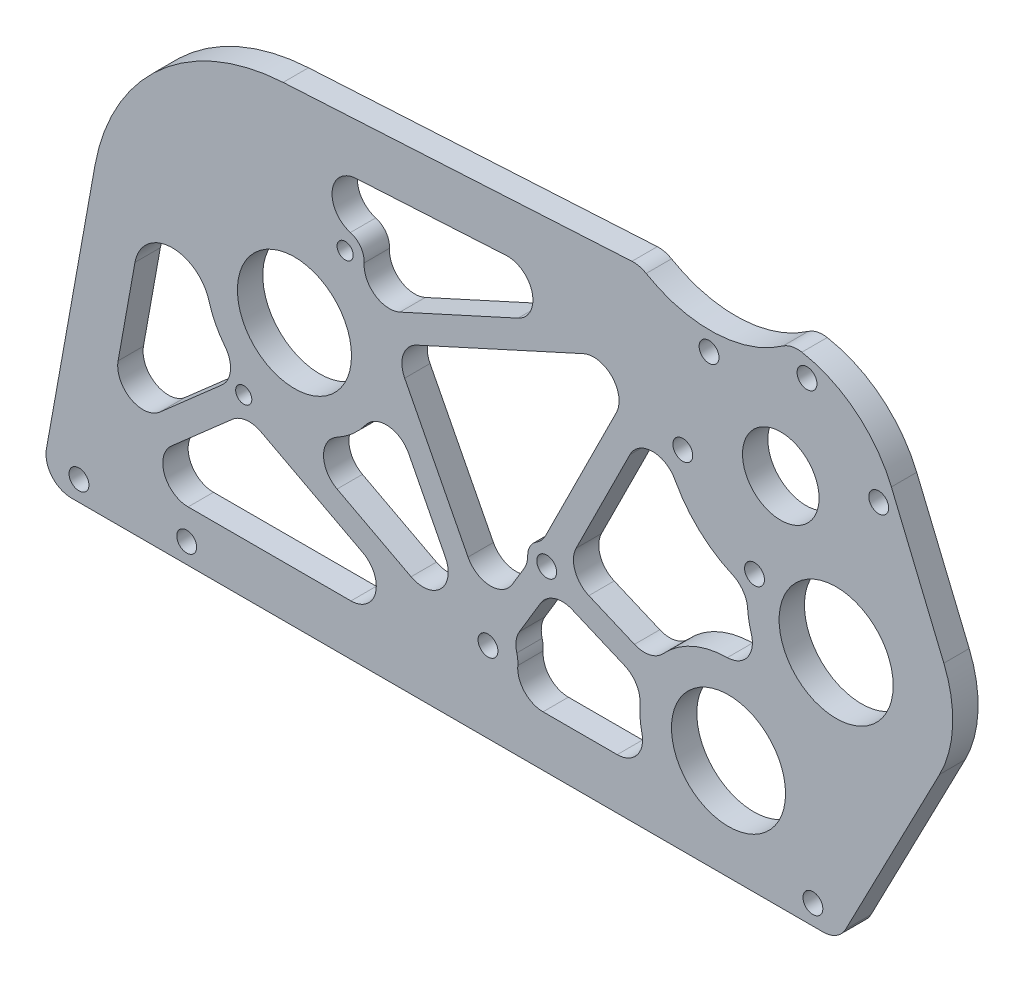
from build123d import *

# Parameters (mm, degrees)
SKETCH7_R           = 2.4892
SKETCH7_R_2         = 14.2875
SKETCH7_R_3         = 9.5885
BOSS_EXTRUDE1_DEPTH = 6.35
FILLET1_R           = 6.35
SKETCH8_R           = 2.0193
CUT_EXTRUDE1_DEPTH  = 423.140912796
CUT_EXTRUDE2_DEPTH  = 423.140912796
FILLET2_R           = 6.35
CUT_EXTRUDE3_DEPTH  = 423.140912939
FILLET3_R           = 6.35


with BuildPart() as part:
    # Sketch7 → Boss-Extrude1 (new body)
    with BuildSketch(Plane.XY):
        with BuildLine():
            Line((149.565619556, 271.446866391), (272.538912647, 278.318852655))
            ThreePointArc((272.538912647, 278.318852655), (290.165667423, 273.771804863), (301.917522958, 259.869574141))
            Line((301.917522958, 259.869574141), (315.061287977, 228.208469575))
            ThreePointArc((315.061287977, 228.208469575), (317.267101924, 215.764974261), (314.010358834, 203.554330738))
            Line((314.010358834, 203.554330738), (288.689766067, 154.7622))
            Line((288.689766067, 154.7622), (88.913712344, 154.7622))
            Line((88.913712344, 154.7622), (102.403069007, 229.723049032))
            ThreePointArc((102.403069007, 229.723049032), (118.739844017, 258.773784419), (149.565619556, 271.446866391))
        make_face()
        with Locations((298.747130287, 254.942184796)):
            Circle(SKETCH7_R, mode=Mode.SUBTRACT)
        with Locations((256.252102058, 266.328693293)):
            Circle(SKETCH7_R, mode=Mode.SUBTRACT)
        with Locations((215.588385064, 199.44728721)):
            Circle(SKETCH7_R, mode=Mode.SUBTRACT)
        with Locations((200.87775722, 174.949776042)):
            Circle(SKETCH7_R, mode=Mode.SUBTRACT)
        with Locations((125.4125, 159.766)):
            Circle(SKETCH7_R, mode=Mode.SUBTRACT)
        with Locations((98.425, 159.766)):
            Circle(SKETCH7_R, mode=Mode.SUBTRACT)
        with Locations((261.120439119, 180.086)):
            Circle(SKETCH7_R_2, mode=Mode.SUBTRACT)
        with Locations((274.2126143, 248.368181051)):
            Circle(SKETCH7_R_3, mode=Mode.SUBTRACT)
        with Locations((152.4, 220.726)):
            Circle(SKETCH7_R_2, mode=Mode.SUBTRACT)
        with Locations((267.638610554, 223.833665063)):
            Circle(SKETCH7_R, mode=Mode.SUBTRACT)
        with Locations((282.260358834, 159.766)):
            Circle(SKETCH7_R, mode=Mode.SUBTRACT)
        with Locations((280.786618045, 272.902697038)):
            Circle(SKETCH7_R, mode=Mode.SUBTRACT)
        with Locations((249.678098312, 241.794177305)):
            Circle(SKETCH7_R, mode=Mode.SUBTRACT)
        with Locations((288.083603848, 217.00897588)):
            Circle(SKETCH7_R_2, mode=Mode.SUBTRACT)
    extrude(amount=BOSS_EXTRUDE1_DEPTH)

    # Fillet1
    fillet1_edges = [part.edges().sort_by_distance(p)[0] for p in [
        (88.913712344, 154.7622, 3.175),
        (288.689766067, 154.7622, 3.175),
    ]]
    fillet(fillet1_edges, radius=FILLET1_R)

    # Sketch8 → Cut-Extrude1 (cut, through all)
    with BuildSketch(Plane.XY.offset(6.35)):
        with Locations((139.7, 198.728954744)):
            Circle(SKETCH8_R)
        with Locations((165.1, 242.723045256)):
            Circle(SKETCH8_R)
    extrude(amount=-CUT_EXTRUDE1_DEPTH, mode=Mode.SUBTRACT)

    # Sketch9 → Cut-Extrude2 (cut, through all)
    with BuildSketch(Plane.XY.offset(6.35)):
        Polygon((192.215699939, 167.4622), (140.153176876, 194.901142091), (108.914200542, 167.4622), align=None)
        with BuildLine():
            Line((105.006311995, 172.481409229), (139.405190931, 202.695870709))
            ThreePointArc((139.405190931, 202.695870709), (134.178706704, 208.000627879), (130.997954718, 214.734081882))
            ThreePointArc((130.997954718, 214.734081882), (121.373696789, 221.680388553), (112.451225035, 213.853063668))
            Line((112.451225035, 213.853063668), (105.006311995, 172.481409229))
        make_face()
        with BuildLine():
            Line((142.856634161, 200.654258833), (199.417379721, 170.84458134))
            Line((199.417379721, 170.84458134), (174.572654292, 219.20152414))
            ThreePointArc((174.572654292, 219.20152414), (163.619402582, 201.540702746), (142.856634161, 200.654258833))
        make_face()
        with BuildLine():
            ThreePointArc((207.090659293, 179.1287284), (207.486615614, 171.430289472), (200.87775722, 167.4622))
            Line((200.87775722, 167.4622), (242.828629516, 167.4622))
            ThreePointArc((242.828629516, 167.4622), (239.225976426, 176.267213756), (239.635081351, 185.771949927))
            Line((239.635081351, 185.771949927), (216.888173338, 195.444463683))
            Line((216.888173338, 195.444463683), (207.090659293, 179.1287284))
        make_face()
        with BuildLine():
            Line((201.093799791, 181.47690264), (211.038996943, 198.038573623))
            ThreePointArc((211.038996943, 198.038573623), (211.412698027, 201.737493318), (214.330991074, 204.040800746))
            Line((214.330991074, 204.040800746), (241.044563722, 257.616188414))
            Line((241.044563722, 257.616188414), (176.970624545, 228.429444292))
            Line((176.970624545, 228.429444292), (201.093799791, 181.47690264))
        make_face()
        with BuildLine():
            Line((219.934905481, 201.049169103), (242.119929287, 191.615581567))
            ThreePointArc((242.119929287, 191.615581567), (250.095157546, 199.383507384), (260.836912993, 202.309191444))
            ThreePointArc((260.836912993, 202.309191444), (265.884096623, 204.913790723), (266.828727377, 210.514297195))
            ThreePointArc((266.828727377, 210.514297195), (265.952059098, 214.972962135), (266.000538862, 219.516737001))
            ThreePointArc((266.000538862, 219.516737001), (249.844329253, 230.874448154), (244.250101279, 249.814493692))
            Line((244.250101279, 249.814493692), (219.934905481, 201.049169103))
        make_face()
        with BuildLine():
            Line((239.155632545, 263.73351591), (167.80481527, 259.746293776))
            ThreePointArc((167.80481527, 259.746293776), (161.848566615, 254.112943231), (166.411048354, 247.301533922))
            ThreePointArc((166.411048354, 247.301533922), (168.990594006, 245.469804171), (169.853223083, 242.425931518))
            ThreePointArc((169.853223083, 242.425931518), (172.590214534, 236.799302216), (178.823152811, 236.251068744))
            Line((178.823152811, 236.251068744), (239.155632545, 263.73351591))
        make_face()
    extrude(amount=-CUT_EXTRUDE2_DEPTH, mode=Mode.SUBTRACT)

    # Fillet2
    fillet2_edges = [part.edges().sort_by_distance(p)[0] for p in [
        (211.038996943, 198.038573623, 3.175),
        (201.093799791, 181.47690264, 3.175),
        (176.970624545, 228.429444292, 3.175),
        (241.044563722, 257.616188414, 3.175),
        (214.330991074, 204.040800746, 3.175),
        (174.572654292, 219.20152414, 3.175),
        (199.417379721, 170.84458134, 3.175),
        (142.856634161, 200.654258833, 3.175),
        (242.828629516, 167.4622, 3.175),
        (200.87775722, 167.4622, 3.175),
        (207.090659293, 179.1287284, 3.175),
        (216.888173338, 195.444463683, 3.175),
        (239.635081351, 185.771949927, 3.175),
        (192.215699939, 167.4622, 3.175),
        (108.914200542, 167.4622, 3.175),
        (140.153176876, 194.901142091, 3.175),
        (242.119929287, 191.615581567, 3.175),
        (219.934905481, 201.049169103, 3.175),
        (244.250101279, 249.814493692, 3.175),
        (266.000538862, 219.516737001, 3.175),
        (139.405190931, 202.695870709, 3.175),
        (239.155632545, 263.73351591, 3.175),
        (105.006311995, 172.481409229, 3.175),
    ]]
    fillet(fillet2_edges, radius=FILLET2_R)

    # Sketch10 → Cut-Extrude3 (cut, through all)
    with BuildSketch(Plane.XY.offset(6.35)):
        with BuildLine():
            Line((276.982728465, 278.567181707), (238.942078671, 276.441396373))
            ThreePointArc((238.942078671, 276.441396373), (258.316701124, 271.164180741), (276.982728465, 278.567181707))
        make_face()
    extrude(amount=-CUT_EXTRUDE3_DEPTH, mode=Mode.SUBTRACT)

    # Fillet3
    fillet3_edges = [part.edges().sort_by_distance(p)[0] for p in [
        (238.942078671, 276.441396373, 3.175),
        (276.622431703, 278.268628988, 3.175),
    ]]
    fillet(fillet3_edges, radius=FILLET3_R)


solid = part.part
